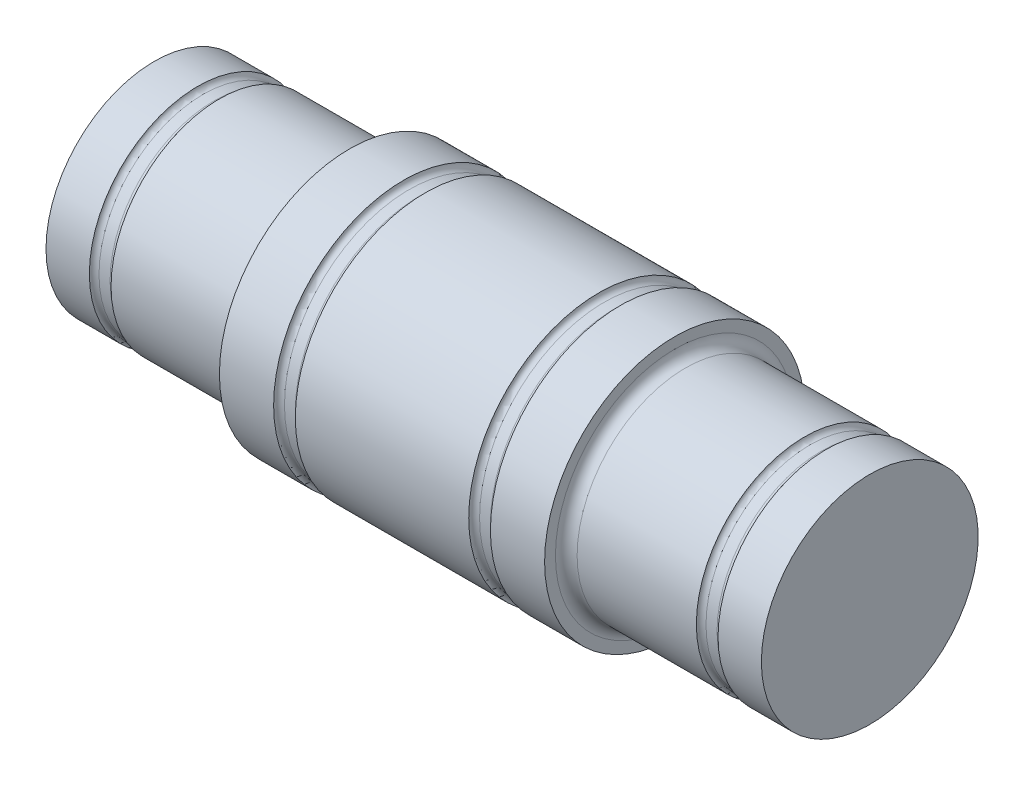
from build123d import *

# Parameters (mm, degrees)
FILLET1_R   = 0.25
FILLET1_R_2 = 0.5


with BuildPart() as part:
    # Sketch1 → Revolve1 (revolve)
    with BuildSketch(Plane.XY, mode=Mode.PRIVATE) as revolve1_sk:
        Polygon((-16.5, 0), (16.5, 0), (16.5, 5), (14.5, 5), (14.5, 4.8), (13.5, 4.8), (13.5, 5), (7.5, 5), (7.5, 6), (5, 6), (5, 5.75), (4, 5.75), (4, 6), (-4, 6), (-4, 5.75), (-5, 5.75), (-5, 6), (-7.5, 6), (-7.5, 5), (-13.5, 5), (-13.5, 4.8), (-14.5, 4.8), (-14.5, 5), (-16.5, 5), align=None)
    revolve(revolve1_sk.sketch.rotate(Axis((-16.5, 0, 0), (1, 0, 0)), 90), axis=Axis((-16.5, 0, 0), (1, 0, 0)))

    # Fillet1
    # the kernel refuses this fillet: 0.5, 0.25 mm, written as the material it adds along each edge
    with BuildSketch(Plane(origin=(-14.5, 0, 0), x_dir=(0, 0, 1), z_dir=(0, 1, 0))) as fillet1_piece_1:
        with BuildLine():
            CenterArc((5.05, 0.244948974), FILLET1_R, 180, 78.463040967)
            Line((5, 0), (4.999, -0.004898979))
            ThreePointArc((4.999, -0.004898979), (4.9, -0.005), (4.8, -0.005))
            Line((4.8, -0.005), (4.795, 0))
            Line((4.795, 0), (4.795, 0.244948974))
            Line((4.795, 0.244948974), (4.8, 0.244948974))
        make_face()
    revolve(axis=Axis((-14.5, 0, 0), (1, 0, 0)))
    with BuildSketch(Plane(origin=(-13.5, 0, 0), x_dir=(0, 0, 1), z_dir=(0, 1, 0))) as fillet1_piece_2:
        with BuildLine():
            CenterArc((5.05, -0.244948974), FILLET1_R, 101.536959033, 78.463040967)
            Line((4.8, -0.244948974), (4.795, -0.244948974))
            Line((4.795, -0.244948974), (4.795, 0))
            Line((4.795, 0), (4.8, 0.005))
            ThreePointArc((4.8, 0.005), (4.9, 0.005), (4.999, 0.004898979))
            Line((4.999, 0.004898979), (5, 0))
        make_face()
    revolve(axis=Axis((-13.5, 0, 0), (1, 0, 0)))
    with BuildSketch(Plane(origin=(13.5, 0, 0), x_dir=(0, 0, 1), z_dir=(0, 1, 0))) as fillet1_piece_3:
        with BuildLine():
            CenterArc((5.05, 0.244948974), FILLET1_R, 180, 78.463040967)
            Line((5, 0), (4.999, -0.004898979))
            ThreePointArc((4.999, -0.004898979), (4.9, -0.005), (4.8, -0.005))
            Line((4.8, -0.005), (4.795, 0))
            Line((4.795, 0), (4.795, 0.244948974))
            Line((4.795, 0.244948974), (4.8, 0.244948974))
        make_face()
    revolve(axis=Axis((13.5, 0, 0), (1, 0, 0)))
    with BuildSketch(Plane(origin=(14.5, 0, 0), x_dir=(0, 0, 1), z_dir=(0, 1, 0))) as fillet1_piece_4:
        with BuildLine():
            CenterArc((5.05, -0.244948974), FILLET1_R, 101.536959033, 78.463040967)
            Line((4.8, -0.244948974), (4.795, -0.244948974))
            Line((4.795, -0.244948974), (4.795, 0))
            Line((4.795, 0), (4.8, 0.005))
            ThreePointArc((4.8, 0.005), (4.9, 0.005), (4.999, 0.004898979))
            Line((4.999, 0.004898979), (5, 0))
        make_face()
    revolve(axis=Axis((14.5, 0, 0), (1, 0, 0)))
    with BuildSketch(Plane(origin=(5, 0, 0), x_dir=(0, 0, 1), z_dir=(0, 1, 0))) as fillet1_piece_5:
        with BuildLine():
            CenterArc((5.75 + FILLET1_R, -FILLET1_R), FILLET1_R, 90, 90)
            Line((5.75, -FILLET1_R), (5.75 - FILLET1_R * 0.02, -FILLET1_R))
            Line((5.75 - FILLET1_R * 0.02, -FILLET1_R), (5.75 - FILLET1_R * 0.02, FILLET1_R * 0.02))
            Line((5.75 - FILLET1_R * 0.02, FILLET1_R * 0.02), (5.75 + FILLET1_R, FILLET1_R * 0.02))
            Line((5.75 + FILLET1_R, FILLET1_R * 0.02), (5.75 + FILLET1_R, 0))
        make_face()
    revolve(axis=Axis((5, 0, 0), (1, 0, 0)))
    with BuildSketch(Plane(origin=(4, 0, 0), x_dir=(0, 0, 1), z_dir=(0, 1, 0))) as fillet1_piece_6:
        with BuildLine():
            CenterArc((5.75 + FILLET1_R, FILLET1_R), FILLET1_R, 180, 90)
            Line((5.75 + FILLET1_R, 0), (5.75 + FILLET1_R, -FILLET1_R * 0.02))
            Line((5.75 + FILLET1_R, -FILLET1_R * 0.02), (5.75 - FILLET1_R * 0.02, -FILLET1_R * 0.02))
            Line((5.75 - FILLET1_R * 0.02, -FILLET1_R * 0.02), (5.75 - FILLET1_R * 0.02, FILLET1_R))
            Line((5.75 - FILLET1_R * 0.02, FILLET1_R), (5.75, FILLET1_R))
        make_face()
    revolve(axis=Axis((4, 0, 0), (1, 0, 0)))
    with BuildSketch(Plane(origin=(-5, 0, 0), x_dir=(0, 0, 1), z_dir=(0, 1, 0))) as fillet1_piece_7:
        with BuildLine():
            CenterArc((5.75 + FILLET1_R, FILLET1_R), FILLET1_R, 180, 90)
            Line((5.75 + FILLET1_R, 0), (5.75 + FILLET1_R, -FILLET1_R * 0.02))
            Line((5.75 + FILLET1_R, -FILLET1_R * 0.02), (5.75 - FILLET1_R * 0.02, -FILLET1_R * 0.02))
            Line((5.75 - FILLET1_R * 0.02, -FILLET1_R * 0.02), (5.75 - FILLET1_R * 0.02, FILLET1_R))
            Line((5.75 - FILLET1_R * 0.02, FILLET1_R), (5.75, FILLET1_R))
        make_face()
    revolve(axis=Axis((-5, 0, 0), (1, 0, 0)))
    with BuildSketch(Plane(origin=(-4, 0, 0), x_dir=(0, 0, 1), z_dir=(0, 1, 0))) as fillet1_piece_8:
        with BuildLine():
            CenterArc((5.75 + FILLET1_R, -FILLET1_R), FILLET1_R, 90, 90)
            Line((5.75, -FILLET1_R), (5.75 - FILLET1_R * 0.02, -FILLET1_R))
            Line((5.75 - FILLET1_R * 0.02, -FILLET1_R), (5.75 - FILLET1_R * 0.02, FILLET1_R * 0.02))
            Line((5.75 - FILLET1_R * 0.02, FILLET1_R * 0.02), (5.75 + FILLET1_R, FILLET1_R * 0.02))
            Line((5.75 + FILLET1_R, FILLET1_R * 0.02), (5.75 + FILLET1_R, 0))
        make_face()
    revolve(axis=Axis((-4, 0, 0), (1, 0, 0)))
    with BuildSketch(Plane(origin=(-7.5, 0, 0), x_dir=(0, 0, 1), z_dir=(0, 1, 0))) as fillet1_piece_9:
        with BuildLine():
            CenterArc((5 + FILLET1_R_2, -FILLET1_R_2), FILLET1_R_2, 90, 90)
            Line((5, -FILLET1_R_2), (5 - FILLET1_R_2 * 0.02, -FILLET1_R_2))
            Line((5 - FILLET1_R_2 * 0.02, -FILLET1_R_2), (5 - FILLET1_R_2 * 0.02, FILLET1_R_2 * 0.02))
            Line((5 - FILLET1_R_2 * 0.02, FILLET1_R_2 * 0.02), (5 + FILLET1_R_2, FILLET1_R_2 * 0.02))
            Line((5 + FILLET1_R_2, FILLET1_R_2 * 0.02), (5 + FILLET1_R_2, 0))
        make_face()
    revolve(axis=Axis((-7.5, 0, 0), (1, 0, 0)))
    with BuildSketch(Plane(origin=(7.5, 0, 0), x_dir=(0, 0, 1), z_dir=(0, 1, 0))) as fillet1_piece_10:
        with BuildLine():
            CenterArc((5 + FILLET1_R_2, FILLET1_R_2), FILLET1_R_2, 180, 90)
            Line((5 + FILLET1_R_2, 0), (5 + FILLET1_R_2, -FILLET1_R_2 * 0.02))
            Line((5 + FILLET1_R_2, -FILLET1_R_2 * 0.02), (5 - FILLET1_R_2 * 0.02, -FILLET1_R_2 * 0.02))
            Line((5 - FILLET1_R_2 * 0.02, -FILLET1_R_2 * 0.02), (5 - FILLET1_R_2 * 0.02, FILLET1_R_2))
            Line((5 - FILLET1_R_2 * 0.02, FILLET1_R_2), (5, FILLET1_R_2))
        make_face()
    revolve(axis=Axis((7.5, 0, 0), (1, 0, 0)))


solid = part.part
